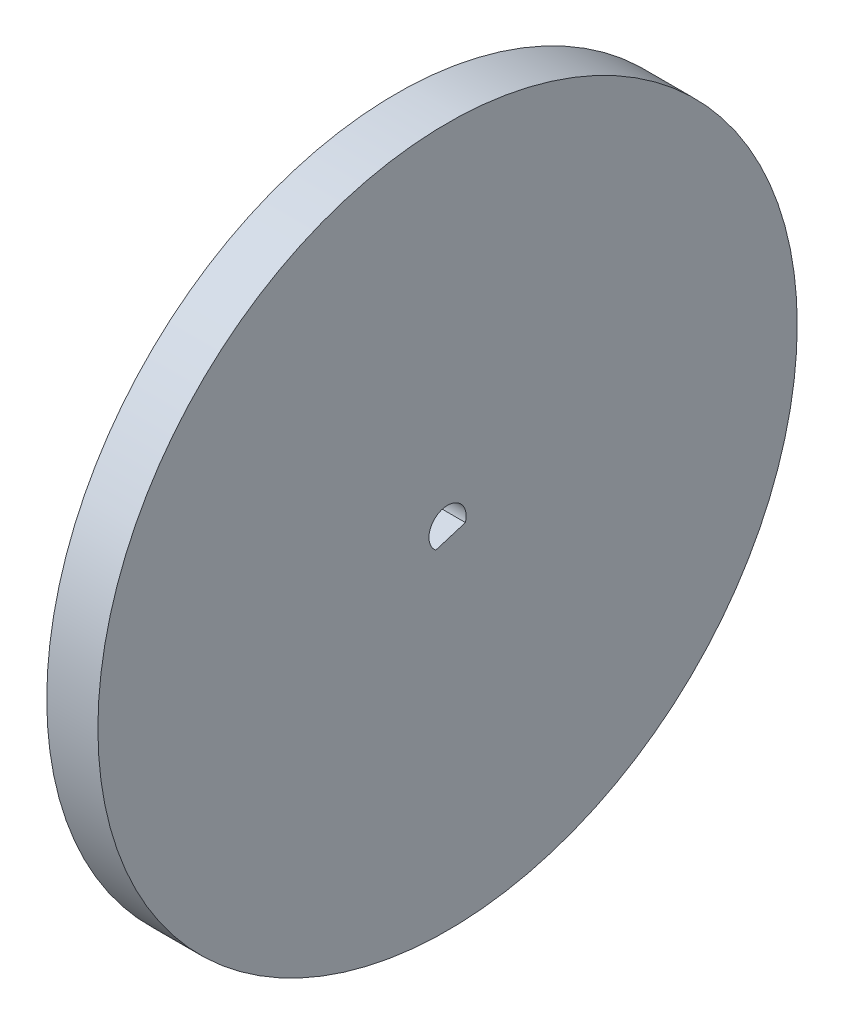
from build123d import *

# Parameters (mm, degrees)
SKETCH1_R           = 43.434
BOSS_EXTRUDE1_DEPTH = 6.35
CUT_EXTRUDE1_DEPTH  = 62.752305317


with BuildPart() as part:
    # Sketch1 → Boss-Extrude1 (new body)
    with BuildSketch(Plane(origin=(0, 0, 0), x_dir=(0, 0, -1), z_dir=(1, 0, 0))):
        Circle(SKETCH1_R)
    extrude(amount=BOSS_EXTRUDE1_DEPTH)

    # Sketch5 → Cut-Extrude1 (cut, through all)
    with BuildSketch(Plane(origin=(6.35, 0, 0), x_dir=(0, 0, -1), z_dir=(1, 0, 0))):
        with BuildLine():
            Line((-1.467338899, -1.785913356), (2.216714185, -0.654788654))
            ThreePointArc((2.216714185, -0.654788654), (-0.678418457, 2.209596877), (-1.467338899, -1.785913356))
        make_face()
    extrude(amount=-CUT_EXTRUDE1_DEPTH, mode=Mode.SUBTRACT)


solid = part.part
